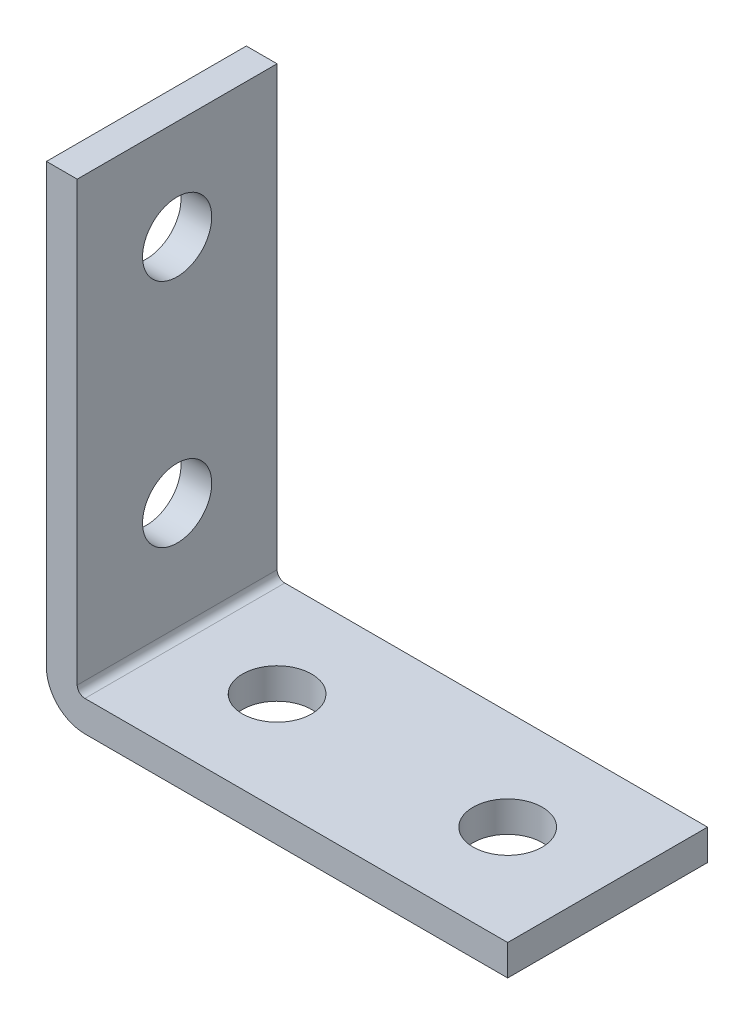
from build123d import *

# Parameters (mm, degrees)
EXTRUDE_THIN1_DEPTH = 20.6375
SKETCH2_R           = 7.14375
CUT_EXTRUDE1_DEPTH  = 135.075629893
SKETCH3_R           = 7.14375
CUT_EXTRUDE2_DEPTH  = 135.225917882


with BuildPart() as part:
    # Sketch1 → Extrude-Thin1 (new, symmetric)
    with BuildSketch(Plane.XY):
        with BuildLine():
            Line((0, 98.425), (0, 7.9375))
            ThreePointArc((0, 7.9375), (2.324839924, 2.324839924), (7.9375, 0))
            Line((7.9375, 0), (95.25, 0))
            Line((95.25, 0), (95.25, 6.35))
            Line((95.25, 6.35), (7.9375, 6.35))
            ThreePointArc((7.9375, 6.35), (6.814967985, 6.814967985), (6.35, 7.9375))
            Line((6.35, 7.9375), (6.35, 98.425))
            Line((6.35, 98.425), (0, 98.425))
        make_face()
    extrude(amount=EXTRUDE_THIN1_DEPTH, both=True)

    # Sketch2 → Cut-Extrude1 (cut, through all)
    with BuildSketch(Plane(origin=(0, 6.35, 0), x_dir=(1, 0, 0), z_dir=(0, 1, 0))):
        with Locations((74.6125, 0)):
            Circle(SKETCH2_R)
        with Locations((26.9875, 0)):
            Circle(SKETCH2_R)
    extrude(amount=-CUT_EXTRUDE1_DEPTH, mode=Mode.SUBTRACT)

    # Sketch3 → Cut-Extrude2 (cut, through all)
    with BuildSketch(Plane(origin=(6.35, 0, 0), x_dir=(0, 0, -1), z_dir=(1, 0, 0))):
        with Locations((0, 77.7875)):
            Circle(SKETCH3_R)
        with Locations((0, 30.1625)):
            Circle(SKETCH3_R)
    extrude(amount=-CUT_EXTRUDE2_DEPTH, mode=Mode.SUBTRACT)


solid = part.part
